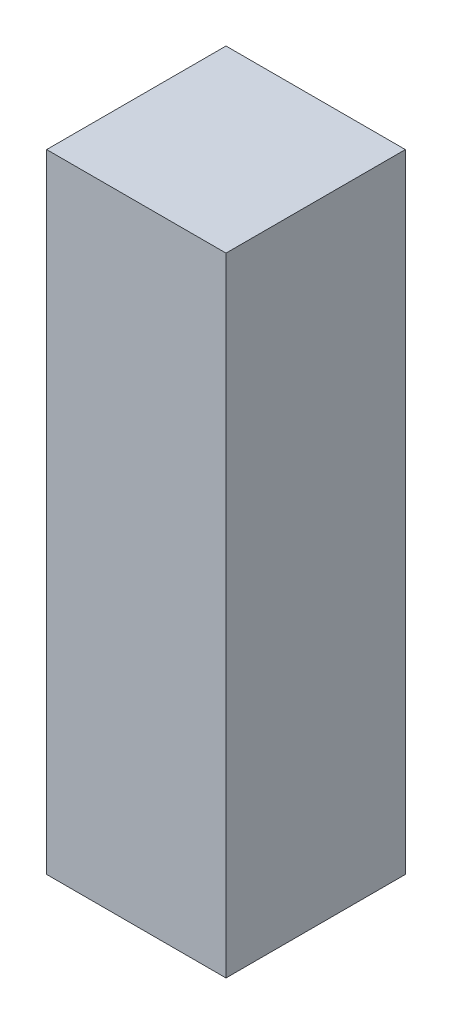
from build123d import *

# Parameters (mm, degrees)
SKETCH1_W           = 20
SKETCH1_H           = 20
BOSS_EXTRUDE1_DEPTH = 70


with BuildPart() as part:
    # Sketch1 → Boss-Extrude1 (new body)
    with BuildSketch(Plane(origin=(0, 0, 0), x_dir=(1, 0, 0), z_dir=(0, 1, 0))):
        Rectangle(SKETCH1_W, SKETCH1_H)
    extrude(amount=BOSS_EXTRUDE1_DEPTH)


solid = part.part
